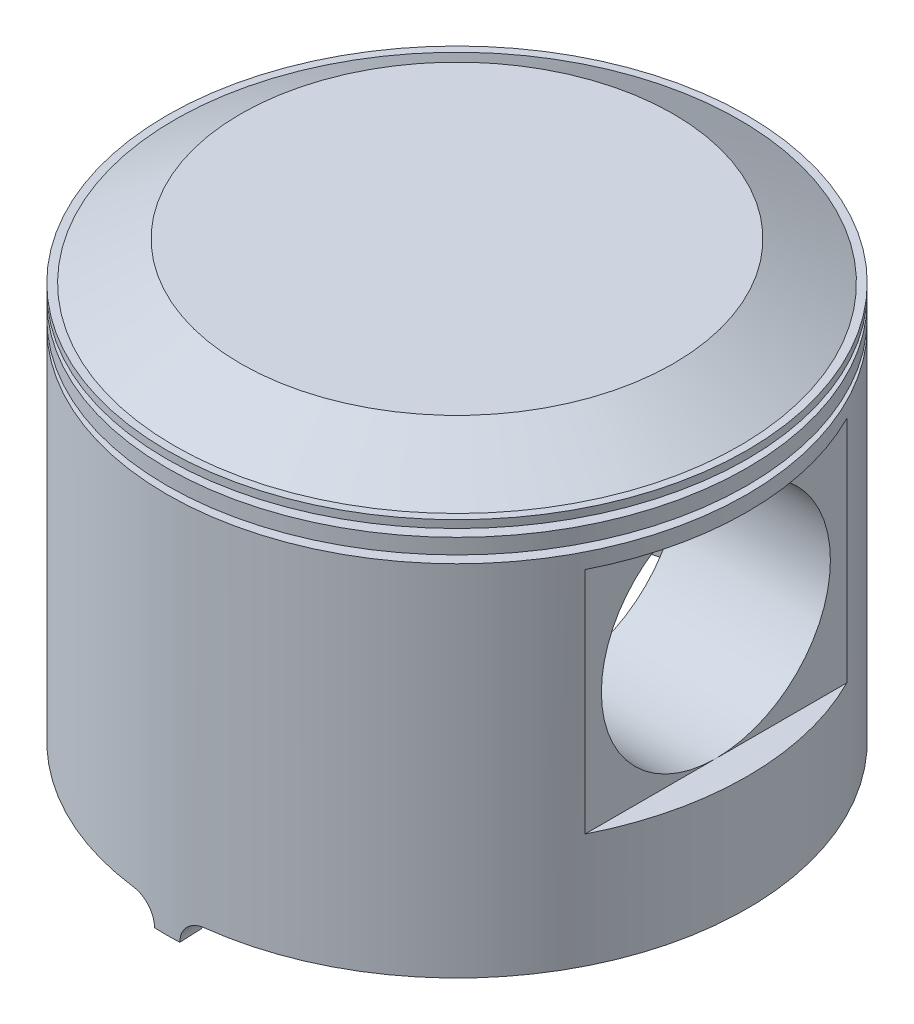
from build123d import *
from build123d.topology import SkipClean

# Parameters (mm, degrees)
BOSS_EXTRUDE1_REACH     = 80.339
CUT_EXTRUDE1_DEPTH      = 87.068697729
CUT_EXTRUDE1_DEPTH_BACK = 87.068697729
GUDGEON_HOLE_R          = 15
CUT_EXTRUDE2_DEPTH      = 103.318131503
RING_CS_W               = 2
RING_CS_H               = 1
BOSS_EXTRUDE2_DEPTH     = 3
FILLET1_R               = 3


with BuildPart() as part:
    # Piston CS → Revolve1 (revolve)
    with BuildSketch(Plane.XY, mode=Mode.PRIVATE) as revolve1_sk:
        Polygon((0, 0), (0, -5), (27, -5), (30, -6.732050808), (30, -16.732050808), (35, -16.732050808), (35, -57), (38, -57), (38, -5), (37, -5), (28.339745962, 0), align=None)
    revolve(revolve1_sk.sketch.rotate(Axis((0, 0, 0), (0, -1, 0)), 90), axis=Axis((0, 0, 0), (0, -1, 0)))

    # Sketch5 → Boss-Extrude1 (add, up to next)
    with BuildSketch(Plane.XZ.offset(57), mode=Mode.PRIVATE) as boss_extrude1_sk1:
        with BuildLine():
            Line((-24.103941586, -38), (-24.103941586, -18))
            Line((-24.103941586, -18), (-14.103941586, -18))
            Line((-14.103941586, -18), (-14.103941586, 18))
            Line((-14.103941586, 18), (-24.103941586, 18))
            Line((-24.103941586, 18), (-24.103941586, 38))
            ThreePointArc((-24.103941586, 38), (-45, 0), (-24.103941586, -38))
        make_face()
    boss_extrude1_tool1 = extrude(boss_extrude1_sk1.sketch, amount=-BOSS_EXTRUDE1_REACH, mode=Mode.PRIVATE) - part.part
    # Sketch5 → Boss-Extrude1 (add, up to next)
    with BuildSketch(Plane.XZ.offset(57), mode=Mode.PRIVATE) as boss_extrude1_sk2:
        with BuildLine():
            Line((24.103941586, 38), (24.103941586, 18))
            Line((24.103941586, 18), (14.103941586, 18))
            Line((14.103941586, 18), (14.103941586, -18))
            Line((14.103941586, -18), (24.103941586, -18))
            Line((24.103941586, -18), (24.103941586, -38))
            ThreePointArc((24.103941586, -38), (45, 0), (24.103941586, 38))
        make_face()
    boss_extrude1_tool2 = extrude(boss_extrude1_sk2.sketch, amount=-BOSS_EXTRUDE1_REACH, mode=Mode.PRIVATE) - part.part
    add(boss_extrude1_tool1.solids().sort_by_distance((-29.359208, -57, 0))[0])
    add(boss_extrude1_tool2.solids().sort_by_distance((29.359208, -57, 0))[0])

    # Gudgeon Hole → Cut-Extrude1 (cut, two sides: drawn at the far end of the back side and taken through both)
    with BuildSketch(Plane(origin=(-14.103941586, 0, 0), x_dir=(0, 0, -1), z_dir=(1, 0, 0)).offset(-CUT_EXTRUDE1_DEPTH_BACK)):
        with Locations((0, -27)):
            Circle(GUDGEON_HOLE_R)
    extrude(amount=CUT_EXTRUDE1_DEPTH + CUT_EXTRUDE1_DEPTH_BACK, mode=Mode.SUBTRACT)

    # Gudgeon Hole Cutouts → Cut-Extrude2 (cut, through all)
    with BuildSketch(Plane.XY.offset(38)):
        with BuildLine():
            Line((33.9141805, -12), (33.9141805, -42))
            Line((33.9141805, -42), (38, -42))
            add(Edge.make_bspline(
                [(38, -42), (32.078947368, -27), (38, -12)],
                knots=[0, 0, 0, 1, 1, 1], degree=2, weights=[0.023, 0.038, 0.053]))
            Line((38, -12), (33.9141805, -12))
        make_face()
        with BuildLine():
            Line((-38, -12), (-33.9141805, -12))
            Line((-33.9141805, -12), (-33.9141805, -42))
            Line((-33.9141805, -42), (-38, -42))
            add(Edge.make_bspline(
                [(-38, -12), (-32.078947368, -27), (-38, -42)],
                knots=[0, 0, 0, 1, 1, 1], degree=2, weights=[0.023, 0.038, 0.053]))
        make_face()
    extrude(amount=-CUT_EXTRUDE2_DEPTH, mode=Mode.SUBTRACT)

    # Ring CS → Cut-Revolve1 (revolve, cut)
    with BuildSketch(Plane.XY, mode=Mode.PRIVATE) as cut_revolve1_sk:
        with Locations((37, -6.5)):
            Rectangle(RING_CS_W, RING_CS_H)
        with Locations((37, -9.5)):
            Rectangle(RING_CS_W, RING_CS_H)
    revolve(cut_revolve1_sk.sketch.rotate(Axis((0, 0, 0), (0, -1, 0)), 90), axis=Axis((0, 0, 0), (0, -1, 0)), mode=Mode.SUBTRACT)

    # Sketch9 → Boss-Extrude2 (add)
    with SkipClean():  # the faces are left unmerged after this step: merging them gives an invalid solid
        with BuildSketch(Plane.XZ.offset(57)):
            with BuildLine():
                Line((-1.526678558, 34.966687755), (-1.65753672, 37.96383242))
                ThreePointArc((-1.65753672, 37.96383242), (0, 38), (1.65753672, 37.96383242))
                Line((1.65753672, 37.96383242), (1.526678558, 34.966687755))
                ThreePointArc((1.526678558, 34.966687755), (0, 35), (-1.526678558, 34.966687755))
            make_face()
            with BuildLine():
                Line((1.526678558, -34.966687755), (1.65753672, -37.96383242))
                ThreePointArc((1.65753672, -37.96383242), (0, -38), (-1.65753672, -37.96383242))
                Line((-1.65753672, -37.96383242), (-1.526678558, -34.966687755))
                ThreePointArc((-1.526678558, -34.966687755), (0, -35), (1.526678558, -34.966687755))
            make_face()
        extrude(amount=BOSS_EXTRUDE2_DEPTH)

    # Fillet1
    # the kernel refuses this fillet: 3 mm, written as the material it adds along each edge
    with BuildSketch(Plane(origin=(1.984682125, -57, 45.456694082), x_dir=(0.9990482215818575, 0, -0.04361938736534301), z_dir=(-0.043619387365343, 0, -0.9990482215818575))) as fillet1_piece_1_section:
        with BuildLine():
            CenterArc((FILLET1_R, FILLET1_R), FILLET1_R, 180, 90)
            Line((0, FILLET1_R), (0, 0))
            Line((0, 0), (FILLET1_R, 0))
        make_face()
    fillet1_piece_1 = extrude(amount=18, mode=Mode.PRIVATE)
    fillet1_piece_1 = fillet1_piece_1 & Plane(origin=(0, -57.679016135, 0), x_dir=(0, 0, 1), z_dir=(0, 1, 0)) * Cylinder(38, 49, mode=Mode.PRIVATE)
    fillet1_piece_1 = fillet1_piece_1 - Plane(origin=(0, -57.679016135, 0), x_dir=(0, 0, 1), z_dir=(0, -1, 0)) * Cylinder(35, 49, mode=Mode.PRIVATE)
    add(fillet1_piece_1)
    with BuildSketch(Plane(origin=(-1.199533153, -57, 27.473826094), x_dir=(-0.999048221581858, 0, -0.04361938736532912), z_dir=(-0.043619387365329124, 0, 0.9990482215818581))) as fillet1_piece_2_section:
        with BuildLine():
            CenterArc((FILLET1_R, FILLET1_R), FILLET1_R, 180, 90)
            Line((0, FILLET1_R), (0, 0))
            Line((0, 0), (FILLET1_R, 0))
        make_face()
    fillet1_piece_2 = extrude(amount=18, mode=Mode.PRIVATE)
    fillet1_piece_2 = fillet1_piece_2 & Plane(origin=(0, -57.679023016, 0), x_dir=(0, 0, 1), z_dir=(0, 1, 0)) * Cylinder(38, 48, mode=Mode.PRIVATE)
    fillet1_piece_2 = fillet1_piece_2 - Plane(origin=(0, -57.679023016, 0), x_dir=(0, 0, 1), z_dir=(0, -1, 0)) * Cylinder(35, 48, mode=Mode.PRIVATE)
    add(fillet1_piece_2)
    with BuildSketch(Plane(origin=(1.199533153, -57, -27.473826094), x_dir=(0.9990482215818575, 0, 0.043619387365343), z_dir=(0.043619387365343, 0, -0.9990482215818575))) as fillet1_piece_3_section:
        with BuildLine():
            CenterArc((FILLET1_R, FILLET1_R), FILLET1_R, 180, 90)
            Line((0, FILLET1_R), (0, 0))
            Line((0, 0), (FILLET1_R, 0))
        make_face()
    fillet1_piece_3 = extrude(amount=18, mode=Mode.PRIVATE)
    fillet1_piece_3 = fillet1_piece_3 & Plane(origin=(0, -57.679021067, 0), x_dir=(0, 0, 1), z_dir=(0, 1, 0)) * Cylinder(38, 49, mode=Mode.PRIVATE)
    fillet1_piece_3 = fillet1_piece_3 - Plane(origin=(0, -57.679021067, 0), x_dir=(0, 0, 1), z_dir=(0, -1, 0)) * Cylinder(35, 49, mode=Mode.PRIVATE)
    add(fillet1_piece_3)
    with BuildSketch(Plane(origin=(-1.984682125, -57, -45.456694082), x_dir=(-0.999048221581858, 0, 0.04361938736532913), z_dir=(0.043619387365329124, 0, 0.9990482215818581))) as fillet1_piece_4_section:
        with BuildLine():
            CenterArc((FILLET1_R, FILLET1_R), FILLET1_R, 180, 90)
            Line((0, FILLET1_R), (0, 0))
            Line((0, 0), (FILLET1_R, 0))
        make_face()
    fillet1_piece_4 = extrude(amount=18, mode=Mode.PRIVATE)
    fillet1_piece_4 = fillet1_piece_4 - Plane(origin=(0, -57.679020805, 0), x_dir=(0, 0, 1), z_dir=(0, -1, 0)) * Cylinder(35, 48, mode=Mode.PRIVATE)
    fillet1_piece_4 = fillet1_piece_4 & Plane(origin=(0, -57.679020805, 0), x_dir=(0, 0, 1), z_dir=(0, 1, 0)) * Cylinder(38, 48, mode=Mode.PRIVATE)
    add(fillet1_piece_4)


solid = part.part
